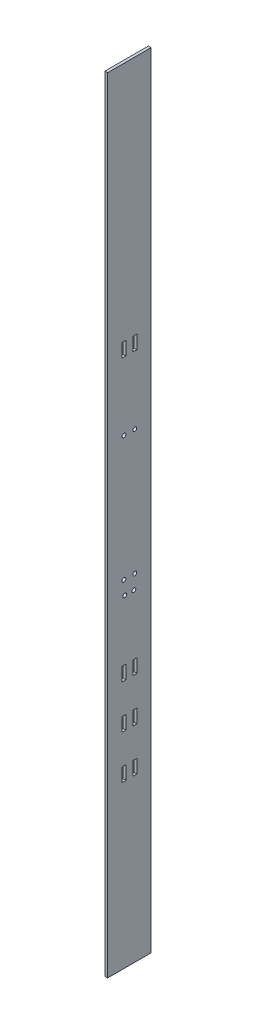
from build123d import *

# Parameters (mm, degrees)
SKETCH1_W                 = 50.8
SKETCH1_H                 = 914.4
BOSS_EXTRUDE1_DEPTH       = 3.175
SKETCH2_W                 = 4.7625
SKETCH2_H                 = 15.875
CUT_EXTRUDE1_DEPTH        = 458.916019184
LPATTERN1_COPY_1_SKETCH_W = 4.7625
LPATTERN1_COPY_1_SKETCH_H = 15.875
LPATTERN1_COPY_1_DEPTH    = 458.916019184
LPATTERN1_COPY_2_SKETCH_W = 4.7625
LPATTERN1_COPY_2_SKETCH_H = 15.875
LPATTERN1_COPY_2_DEPTH    = 458.916019184
LPATTERN1_COPY_3_SKETCH_W = 4.7625
LPATTERN1_COPY_3_SKETCH_H = 15.875
LPATTERN1_COPY_3_DEPTH    = 458.916019184
LPATTERN1_COPY_4_SKETCH_W = 4.7625
LPATTERN1_COPY_4_SKETCH_H = 15.875
LPATTERN1_COPY_4_DEPTH    = 458.916019184
LPATTERN1_COPY_5_SKETCH_W = 4.7625
LPATTERN1_COPY_5_SKETCH_H = 15.875
LPATTERN1_COPY_5_DEPTH    = 458.916019184
LPATTERN1_COPY_6_SKETCH_W = 4.7625
LPATTERN1_COPY_6_SKETCH_H = 15.875
LPATTERN1_COPY_6_DEPTH    = 458.916019184
SKETCH3_W                 = 4.7625
SKETCH3_H                 = 15.875
CUT_EXTRUDE2_DEPTH        = 458.916019184
F_8_CLEARANCE_HOLE1_D     = 4.4958


with BuildPart() as part:
    # Sketch1 → Boss-Extrude1 (new body)
    with BuildSketch(Plane(origin=(0, 0, 0), x_dir=(0, 0, -1), z_dir=(1, 0, 0))):
        Rectangle(SKETCH1_W, SKETCH1_H)
    extrude(amount=BOSS_EXTRUDE1_DEPTH)

    # Sketch2 → Cut-Extrude1 (cut, through all)
    with BuildSketch(Plane(origin=(3.175, 0, 0), x_dir=(0, 0, -1), z_dir=(1, 0, 0))):
        with Locations((6.38125, -209.55)):
            Rectangle(SKETCH2_W, SKETCH2_H)
    cut_extrude1 = extrude(amount=-CUT_EXTRUDE1_DEPTH, mode=Mode.SUBTRACT)

    # Mirror1: Cut-Extrude1 across plane
    add(cut_extrude1.mirror(Plane.XY), mode=Mode.SUBTRACT)

    # LPattern1 copy 1 sketch → LPattern1 copy 1 (cut, through all)
    with BuildSketch(Plane(origin=(3.175, -50.8, 0), x_dir=(0, 0, 1), z_dir=(1, 0, 0))):
        with Locations((6.38125, 209.55)):
            Rectangle(LPATTERN1_COPY_1_SKETCH_W, LPATTERN1_COPY_1_SKETCH_H)
    extrude(amount=-LPATTERN1_COPY_1_DEPTH, mode=Mode.SUBTRACT)

    # LPattern1 copy 2 sketch → LPattern1 copy 2 (cut, through all)
    with BuildSketch(Plane(origin=(3.175, 50.8, 0), x_dir=(0, 0, 1), z_dir=(1, 0, 0))):
        with Locations((6.38125, 209.55)):
            Rectangle(LPATTERN1_COPY_2_SKETCH_W, LPATTERN1_COPY_2_SKETCH_H)
    extrude(amount=-LPATTERN1_COPY_2_DEPTH, mode=Mode.SUBTRACT)

    # LPattern1 copy 3 sketch → LPattern1 copy 3 (cut, through all)
    with BuildSketch(Plane(origin=(3.175, 0, 0), x_dir=(0, 0, 1), z_dir=(1, 0, 0))):
        with Locations((6.38125, 209.55)):
            Rectangle(LPATTERN1_COPY_3_SKETCH_W, LPATTERN1_COPY_3_SKETCH_H)
    extrude(amount=-LPATTERN1_COPY_3_DEPTH, mode=Mode.SUBTRACT)

    # LPattern1 copy 4 sketch → LPattern1 copy 4 (cut, through all)
    with BuildSketch(Plane(origin=(3.175, -50.8, 0), x_dir=(0, 0, -1), z_dir=(1, 0, 0))):
        with Locations((6.38125, -209.55)):
            Rectangle(LPATTERN1_COPY_4_SKETCH_W, LPATTERN1_COPY_4_SKETCH_H)
    extrude(amount=-LPATTERN1_COPY_4_DEPTH, mode=Mode.SUBTRACT)

    # LPattern1 copy 5 sketch → LPattern1 copy 5 (cut, through all)
    with BuildSketch(Plane(origin=(3.175, 50.8, 0), x_dir=(0, 0, -1), z_dir=(1, 0, 0))):
        with Locations((6.38125, -209.55)):
            Rectangle(LPATTERN1_COPY_5_SKETCH_W, LPATTERN1_COPY_5_SKETCH_H)
    extrude(amount=-LPATTERN1_COPY_5_DEPTH, mode=Mode.SUBTRACT)

    # LPattern1 copy 6 sketch → LPattern1 copy 6 (cut, through all)
    with BuildSketch(Plane(origin=(3.175, 0, 0), x_dir=(0, 0, -1), z_dir=(1, 0, 0))):
        with Locations((6.38125, -209.55)):
            Rectangle(LPATTERN1_COPY_6_SKETCH_W, LPATTERN1_COPY_6_SKETCH_H)
    extrude(amount=-LPATTERN1_COPY_6_DEPTH, mode=Mode.SUBTRACT)

    # Sketch3 → Cut-Extrude2 (cut, through all)
    with BuildSketch(Plane(origin=(3.175, 0, 0), x_dir=(0, 0, -1), z_dir=(1, 0, 0))):
        with Locations((6.38125, 168.275)):
            Rectangle(SKETCH3_W, SKETCH3_H)
        with Locations((-6.38125, 168.275)):
            Rectangle(SKETCH3_W, SKETCH3_H)
    extrude(amount=-CUT_EXTRUDE2_DEPTH, mode=Mode.SUBTRACT)

    # #8 Clearance Hole1 (through all)
    with Locations(Plane(origin=(3.175, 0, 0), x_dir=(0, 0, -1), z_dir=(1, 0, 0))):
        with Locations((6.35, -64.523692353), (-6.35, -64.523692353), (6.35, 81.271985669), (-6.35, 81.271985669), (5.25, -80.765552879), (-5.25, -80.765552879)):
            Hole(F_8_CLEARANCE_HOLE1_D / 2)


solid = part.part
